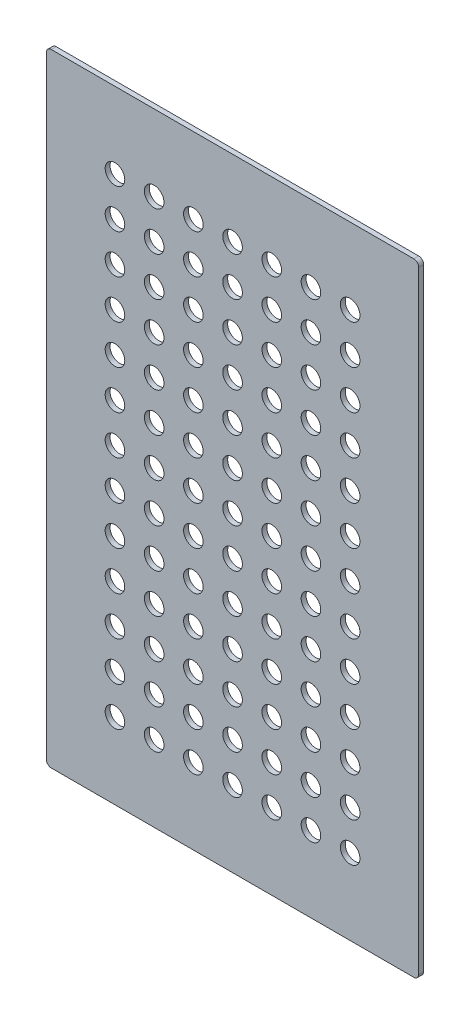
from build123d import *

# Parameters (mm, degrees)
SKETCH_1_W        = 76
SKETCH_1_H        = 127
EXTRUDE_1_DEPTH   = 1
FILLET_1_R        = 1
OTHER_2_OUTLINE_R = 2
OTHER_2_DEPTH     = 1


# Read off the part's stored shape, not the designer's step: 填充阵列2
with BuildPart() as part:
    # 草图1 → 凸台-拉伸1 (new body)
    with BuildSketch(Plane.XY):
        with Locations((-38, -63.5)):
            Rectangle(SKETCH_1_W, SKETCH_1_H)
    extrude(amount=EXTRUDE_1_DEPTH)

    # 圆角1
    fillet_1_edges = [part.edges().sort_by_distance(p)[0] for p in [
        (0, -127, 0.5),
        (-76, -127, 0.5),
        (-76, 0, 0.5),
        (0, 0, 0.5),
    ]]
    fillet(fillet_1_edges, radius=FILLET_1_R)

    # 填充阵列2 outline → 填充阵列2 (cut)
    with BuildSketch(Plane.XY):
        with Locations((-38, -63.5)):
            Circle(OTHER_2_OUTLINE_R)
        with Locations((-38, -23.5)):
            Circle(OTHER_2_OUTLINE_R)
        with Locations((-46, -23.5)):
            Circle(OTHER_2_OUTLINE_R)
        with Locations((-54, -23.5)):
            Circle(OTHER_2_OUTLINE_R)
        with Locations((-62, -23.5)):
            Circle(OTHER_2_OUTLINE_R)
        with Locations((-14, -31.5)):
            Circle(OTHER_2_OUTLINE_R)
        with Locations((-22, -31.5)):
            Circle(OTHER_2_OUTLINE_R)
        with Locations((-30, -31.5)):
            Circle(OTHER_2_OUTLINE_R)
        with Locations((-38, -31.5)):
            Circle(OTHER_2_OUTLINE_R)
        with Locations((-30, -39.5)):
            Circle(OTHER_2_OUTLINE_R)
        with Locations((-62, -111.5)):
            Circle(OTHER_2_OUTLINE_R)
        with Locations((-38, -39.5)):
            Circle(OTHER_2_OUTLINE_R)
        with Locations((-54, -111.5)):
            Circle(OTHER_2_OUTLINE_R)
        with Locations((-46, -31.5)):
            Circle(OTHER_2_OUTLINE_R)
        with Locations((-54, -31.5)):
            Circle(OTHER_2_OUTLINE_R)
        with Locations((-62, -31.5)):
            Circle(OTHER_2_OUTLINE_R)
        with Locations((-22, -39.5)):
            Circle(OTHER_2_OUTLINE_R)
        with Locations((-14, -15.5)):
            Circle(OTHER_2_OUTLINE_R)
        with Locations((-22, -15.5)):
            Circle(OTHER_2_OUTLINE_R)
        with Locations((-62, -15.5)):
            Circle(OTHER_2_OUTLINE_R)
        with Locations((-14, -23.5)):
            Circle(OTHER_2_OUTLINE_R)
        with Locations((-22, -23.5)):
            Circle(OTHER_2_OUTLINE_R)
        with Locations((-30, -23.5)):
            Circle(OTHER_2_OUTLINE_R)
        with Locations((-54, -15.5)):
            Circle(OTHER_2_OUTLINE_R)
        with Locations((-46, -15.5)):
            Circle(OTHER_2_OUTLINE_R)
        with Locations((-38, -15.5)):
            Circle(OTHER_2_OUTLINE_R)
        with Locations((-30, -15.5)):
            Circle(OTHER_2_OUTLINE_R)
        with Locations((-14, -87.5)):
            Circle(OTHER_2_OUTLINE_R)
        with Locations((-38, -55.5)):
            Circle(OTHER_2_OUTLINE_R)
        with Locations((-46, -79.5)):
            Circle(OTHER_2_OUTLINE_R)
        with Locations((-22, -87.5)):
            Circle(OTHER_2_OUTLINE_R)
        with Locations((-38, -79.5)):
            Circle(OTHER_2_OUTLINE_R)
        with Locations((-46, -55.5)):
            Circle(OTHER_2_OUTLINE_R)
        with Locations((-14, -79.5)):
            Circle(OTHER_2_OUTLINE_R)
        with Locations((-30, -79.5)):
            Circle(OTHER_2_OUTLINE_R)
        with Locations((-14, -95.5)):
            Circle(OTHER_2_OUTLINE_R)
        with Locations((-54, -63.5)):
            Circle(OTHER_2_OUTLINE_R)
        with Locations((-46, -87.5)):
            Circle(OTHER_2_OUTLINE_R)
        with Locations((-22, -95.5)):
            Circle(OTHER_2_OUTLINE_R)
        with Locations((-54, -79.5)):
            Circle(OTHER_2_OUTLINE_R)
        with Locations((-30, -87.5)):
            Circle(OTHER_2_OUTLINE_R)
        with Locations((-54, -71.5)):
            Circle(OTHER_2_OUTLINE_R)
        with Locations((-38, -87.5)):
            Circle(OTHER_2_OUTLINE_R)
        with Locations((-22, -63.5)):
            Circle(OTHER_2_OUTLINE_R)
        with Locations((-30, -71.5)):
            Circle(OTHER_2_OUTLINE_R)
        with Locations((-14, -47.5)):
            Circle(OTHER_2_OUTLINE_R)
        with Locations((-22, -55.5)):
            Circle(OTHER_2_OUTLINE_R)
        with Locations((-30, -55.5)):
            Circle(OTHER_2_OUTLINE_R)
        with Locations((-22, -47.5)):
            Circle(OTHER_2_OUTLINE_R)
        with Locations((-14, -39.5)):
            Circle(OTHER_2_OUTLINE_R)
        with Locations((-30, -63.5)):
            Circle(OTHER_2_OUTLINE_R)
        with Locations((-46, -71.5)):
            Circle(OTHER_2_OUTLINE_R)
        with Locations((-22, -79.5)):
            Circle(OTHER_2_OUTLINE_R)
        with Locations((-14, -71.5)):
            Circle(OTHER_2_OUTLINE_R)
        with Locations((-46, -63.5)):
            Circle(OTHER_2_OUTLINE_R)
        with Locations((-14, -55.5)):
            Circle(OTHER_2_OUTLINE_R)
        with Locations((-38, -71.5)):
            Circle(OTHER_2_OUTLINE_R)
        with Locations((-22, -71.5)):
            Circle(OTHER_2_OUTLINE_R)
        with Locations((-14, -63.5)):
            Circle(OTHER_2_OUTLINE_R)
        with Locations((-62, -55.5)):
            Circle(OTHER_2_OUTLINE_R)
        with Locations((-46, -103.5)):
            Circle(OTHER_2_OUTLINE_R)
        with Locations((-22, -111.5)):
            Circle(OTHER_2_OUTLINE_R)
        with Locations((-62, -47.5)):
            Circle(OTHER_2_OUTLINE_R)
        with Locations((-14, -111.5)):
            Circle(OTHER_2_OUTLINE_R)
        with Locations((-38, -103.5)):
            Circle(OTHER_2_OUTLINE_R)
        with Locations((-62, -95.5)):
            Circle(OTHER_2_OUTLINE_R)
        with Locations((-62, -63.5)):
            Circle(OTHER_2_OUTLINE_R)
        with Locations((-38, -111.5)):
            Circle(OTHER_2_OUTLINE_R)
        with Locations((-54, -39.5)):
            Circle(OTHER_2_OUTLINE_R)
        with Locations((-46, -111.5)):
            Circle(OTHER_2_OUTLINE_R)
        with Locations((-46, -39.5)):
            Circle(OTHER_2_OUTLINE_R)
        with Locations((-62, -103.5)):
            Circle(OTHER_2_OUTLINE_R)
        with Locations((-62, -39.5)):
            Circle(OTHER_2_OUTLINE_R)
        with Locations((-30, -111.5)):
            Circle(OTHER_2_OUTLINE_R)
        with Locations((-54, -103.5)):
            Circle(OTHER_2_OUTLINE_R)
        with Locations((-62, -87.5)):
            Circle(OTHER_2_OUTLINE_R)
        with Locations((-38, -95.5)):
            Circle(OTHER_2_OUTLINE_R)
        with Locations((-14, -103.5)):
            Circle(OTHER_2_OUTLINE_R)
        with Locations((-46, -47.5)):
            Circle(OTHER_2_OUTLINE_R)
        with Locations((-54, -55.5)):
            Circle(OTHER_2_OUTLINE_R)
        with Locations((-54, -87.5)):
            Circle(OTHER_2_OUTLINE_R)
        with Locations((-30, -95.5)):
            Circle(OTHER_2_OUTLINE_R)
        with Locations((-54, -47.5)):
            Circle(OTHER_2_OUTLINE_R)
        with Locations((-30, -47.5)):
            Circle(OTHER_2_OUTLINE_R)
        with Locations((-30, -103.5)):
            Circle(OTHER_2_OUTLINE_R)
        with Locations((-54, -95.5)):
            Circle(OTHER_2_OUTLINE_R)
        with Locations((-62, -71.5)):
            Circle(OTHER_2_OUTLINE_R)
        with Locations((-38, -47.5)):
            Circle(OTHER_2_OUTLINE_R)
        with Locations((-22, -103.5)):
            Circle(OTHER_2_OUTLINE_R)
        with Locations((-46, -95.5)):
            Circle(OTHER_2_OUTLINE_R)
        with Locations((-62, -79.5)):
            Circle(OTHER_2_OUTLINE_R)
    extrude(amount=OTHER_2_DEPTH, mode=Mode.SUBTRACT)


solid = part.part
